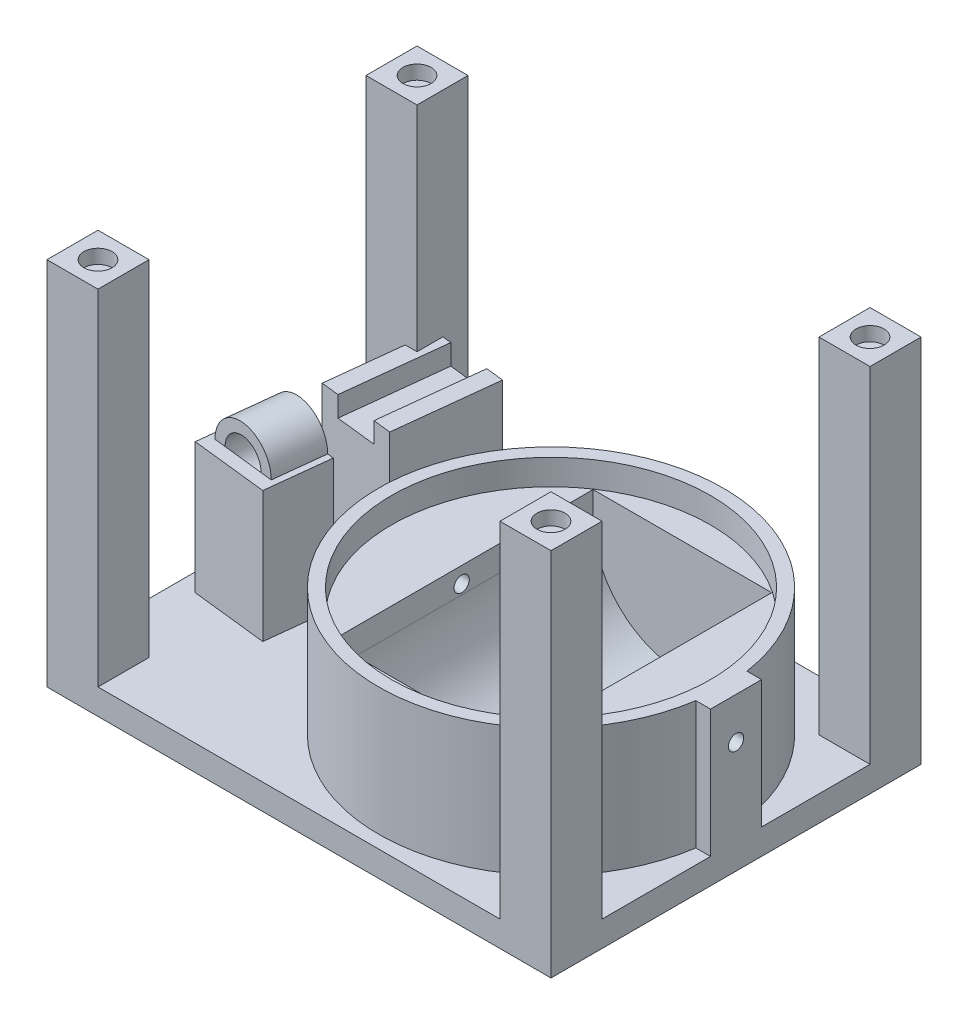
from build123d import *
from build123d.topology import SkipClean

# Parameters (mm, degrees)
SKETCH1_W              = 39.5
SKETCH1_H              = 29
BOSS_EXTRUDE1_DEPTH    = 2
SKETCH2_R              = 13.5
SKETCH2_R_2            = 8.5
BOSS_EXTRUDE2_DEPTH    = 10
SKETCH3_R              = 12.5
CUT_EXTRUDE1_DEPTH     = 2
SKETCH4_R              = 7.5
CUT_EXTRUDE2_DEPTH     = 9
CUT_EXTRUDE3_START     = -10.3
CUT_EXTRUDE3_DEPTH     = 20.6
BOSS_EXTRUDE3_DEPTH    = 10
SKETCH10_W             = 39.5
SKETCH10_H             = 29
SKETCH10_R             = 13.5
CUT_EXTRUDE4_DEPTH     = 10
SKETCH11_R             = 13.5
SKETCH11_W             = 14
SKETCH11_H             = 20.6
BOSS_EXTRUDE4_DEPTH    = 8
SKETCH12_R             = 13.5
SKETCH12_R_2           = 12.5
BOSS_EXTRUDE5_DEPTH    = 2
CUT_SWEEP2_START       = -214.83981443
CUT_SWEEP2_OUTLINE_R   = 0.6
CUT_SWEEP2_DEPTH       = 22.83981443
CUT_SWEEP2_2_OUTLINE_R = 0.6
CUT_SWEEP2_2_ANGLE     = 17.195102
CUT_SWEEP2_START_2     = -205
CUT_SWEEP2_3_OUTLINE_R = 0.6
CUT_SWEEP2_3_DEPTH     = 2.526605635
BOSS_EXTRUDE7_DEPTH    = 10.25
CUT_EXTRUDE5_DEPTH     = 8
SKETCH20_R             = 1.6
CUT_EXTRUDE6_DEPTH     = 4
SKETCH21_R             = 2.5
SKETCH21_R_2           = 1.6
BOSS_EXTRUDE8_DEPTH    = 4
SKETCH22_W             = 4
SKETCH22_H             = 4
BOSS_EXTRUDE9_DEPTH    = 27
BOSS_EXTRUDE11_DEPTH   = 10
SKETCH8_2_R            = 0.6
SKETCH24_R             = 1.1
CUT_EXTRUDE7_DEPTH     = 1.1


with BuildPart() as part:
    # Sketch1 → Boss-Extrude1 (new body)
    with BuildSketch(Plane(origin=(0, 0, 0), x_dir=(1, 0, 0), z_dir=(0, 1, 0))):
        with Locations((-212.126239175, -24.349172792)):
            Rectangle(SKETCH1_W, SKETCH1_H)
    extrude(amount=BOSS_EXTRUDE1_DEPTH)

    # Sketch2 → Boss-Extrude2 (add)
    with BuildSketch(Plane(origin=(0, 2, 0), x_dir=(1, 0, 0), z_dir=(0, 1, 0))):
        with Locations((-206.876239175, -24.349172792)):
            Circle(SKETCH2_R)
        with Locations((-222.376239175, -24.349172792)):
            Circle(SKETCH2_R_2)
    extrude(amount=BOSS_EXTRUDE2_DEPTH)

    # Sketch3 → Cut-Extrude1 (cut)
    with BuildSketch(Plane(origin=(0, 12, 0), x_dir=(1, 0, 0), z_dir=(0, 1, 0))):
        with Locations(Location((-206.876239175, -24.349172792, 0), (0, 0, 270))):
            Circle(SKETCH3_R)
    extrude(amount=-CUT_EXTRUDE1_DEPTH, mode=Mode.SUBTRACT)

    # Sketch4 → Cut-Extrude2 (cut)
    with BuildSketch(Plane(origin=(0, 12, 0), x_dir=(1, 0, 0), z_dir=(0, 1, 0))):
        with Locations(Location((-222.376239175, -24.349172792, 0), (0, 0, 270))):
            Circle(SKETCH4_R)
    extrude(amount=-CUT_EXTRUDE2_DEPTH, mode=Mode.SUBTRACT)

    # Cut-Extrude3: read off the stored shape, not the designer's step
    # Cut-Extrude3 outline → Cut-Extrude3 (cut)
    with BuildSketch(Plane.XY.offset(24.349172792).offset(CUT_EXTRUDE3_START)):
        with BuildLine():
            ThreePointArc((-213.876239175, 8), (-206.876239175, 1), (-199.876239175, 8))
            Line((-199.876239175, 8), (-199.876239175, 10))
            Line((-199.876239175, 10), (-213.876239175, 10))
            Line((-213.876239175, 10), (-213.876239175, 8))
        make_face()
    extrude(amount=CUT_EXTRUDE3_DEPTH, mode=Mode.SUBTRACT)

    # Sketch7 → Boss-Extrude3 (add)
    with BuildSketch(Plane(origin=(0, 2, 0), x_dir=(1, 0, 0), z_dir=(0, 1, 0))):
        with BuildLine():
            Line((-192.376239175, -26.349172792), (-192.376239175, -24.349172792))
            Line((-192.376239175, -24.349172792), (-192.376239175, -22.349172792))
            Line((-192.376239175, -22.349172792), (-193.525209252, -22.349172792))
            ThreePointArc((-193.525209252, -22.349172792), (-193.413533207, -23.346402619), (-193.376239175, -24.349172792))
            ThreePointArc((-193.376239175, -24.349172792), (-193.413533207, -25.351942966), (-193.525209252, -26.349172792))
            Line((-193.525209252, -26.349172792), (-192.376239175, -26.349172792))
        make_face()
    extrude(amount=BOSS_EXTRUDE3_DEPTH)

    # Sketch10 → Cut-Extrude4 (cut)
    with BuildSketch(Plane(origin=(0, 2, 0), x_dir=(1, 0, 0), z_dir=(0, 1, 0))):
        with Locations((-212.126239175, -24.349172792)):
            Rectangle(SKETCH10_W, SKETCH10_H)
        with Locations(Location((-206.876239175, -24.349172792, 0), (0, 0, 151.062655238))):
            Circle(SKETCH10_R, mode=Mode.SUBTRACT)
    extrude(amount=CUT_EXTRUDE4_DEPTH, mode=Mode.SUBTRACT)

    # Sketch11 → Boss-Extrude4 (add)
    with BuildSketch(Plane(origin=(0, 2, 0), x_dir=(1, 0, 0), z_dir=(0, 1, 0))):
        with Locations(Location((-206.876239175, -24.349172792, 0), (0, 0, 151.062655238))):
            Circle(SKETCH11_R)
        with Locations((-206.876239175, -24.349172792)):
            Rectangle(SKETCH11_W, SKETCH11_H, mode=Mode.SUBTRACT)
    extrude(amount=BOSS_EXTRUDE4_DEPTH)

    # Sketch12 → Boss-Extrude5 (add)
    with SkipClean():  # the faces are left unmerged after this step: merging them gives an invalid solid
        with BuildSketch(Plane(origin=(0, 10, 0), x_dir=(1, 0, 0), z_dir=(0, 1, 0))):
            with Locations(Location((-206.876239175, -24.349172792, 0), (0, 0, 270))):
                Circle(SKETCH12_R)
            with Locations(Location((-206.876239175, -24.349172792, 0), (0, 0, 270))):
                Circle(SKETCH12_R_2, mode=Mode.SUBTRACT)
        extrude(amount=BOSS_EXTRUDE5_DEPTH)
    add(part.part.scale(1), mode=Mode.REPLACE)  # the faces are merged on a copy

    # Cut-Sweep2: read off the stored shape, not the designer's step
    # Cut-Sweep2 outline → Cut-Sweep2 (cut)
    with SkipClean():  # the faces are left unmerged after this step: merging them gives an invalid solid
        with BuildSketch(Plane.YZ.offset(CUT_SWEEP2_START)):
            with Locations((8.75, 24.349172792)):
                Circle(CUT_SWEEP2_OUTLINE_R)
        extrude(amount=CUT_SWEEP2_DEPTH, mode=Mode.SUBTRACT)

    # Cut-Sweep2 2 outline → Cut-Sweep2 2 (revolve, cut)
    with SkipClean():  # the faces are left unmerged after this step: merging them gives an invalid solid
        with BuildSketch(Plane(origin=(-214.83981433, 0, 9.349172792), x_dir=(-0.2956263792524328, 0, 0.9553036396298806), z_dir=(-0.9553036396298806, 0, -0.2956263792524328))):
            with Locations((15, 8.75)):
                Circle(CUT_SWEEP2_2_OUTLINE_R)
        revolve(axis=Axis((-214.83981433, 0, 9.349172792), (0, 1, 0)), revolution_arc=CUT_SWEEP2_2_ANGLE, mode=Mode.SUBTRACT)

    # Cut-Sweep2 3 outline → Cut-Sweep2 3 (cut)
    with SkipClean():  # the faces are left unmerged after this step: merging them gives an invalid solid
        with BuildSketch(Plane(origin=(0, 0, 0), x_dir=(0, 1, 0), z_dir=(0.9553036396298961, 0, 0.29562637925238305)).offset(CUT_SWEEP2_START_2)):
            with Locations((8.75, 87.443615225)):
                Circle(CUT_SWEEP2_3_OUTLINE_R)
        extrude(amount=CUT_SWEEP2_3_DEPTH, mode=Mode.SUBTRACT)

    # Sketch18 → Boss-Extrude7 (add)
    with SkipClean():  # the faces are left unmerged after this step: merging them gives an invalid solid
        with BuildSketch(Plane(origin=(0, 2, 0), x_dir=(1, 0, 0), z_dir=(0, 1, 0))):
            Polygon((-228.567210955, -11.746276031), (-229.459691419, -19.696337579), (-226.478418338, -20.031017753), (-225.585937874, -12.080956204), align=None)
            Polygon((-225.585937874, -12.080956204), (-226.478418338, -20.031017753), (-223.497145257, -20.365697927), (-222.604664794, -12.415636378), align=None)
            Polygon((-227.482458859, -28.974836995), (-226.92465857, -24.006048527), (-229.90593165, -23.671368353), (-230.46373194, -28.640156821), align=None)
            Polygon((-223.943385489, -24.340728701), (-226.92465857, -24.006048527), (-227.482458859, -28.974836995), (-224.501185779, -29.309517169), align=None)
        extrude(amount=BOSS_EXTRUDE7_DEPTH)

    # Sketch19 → Cut-Extrude5 (cut)
    with SkipClean():  # the faces are left unmerged after this step: merging them gives an invalid solid
        with BuildSketch(Plane(origin=(-5.039382401, 0, 44.889946486), x_dir=(0.9937576935397466, 0, 0.11156005795338761), z_dir=(-0.11156005795338761, 0, 0.9937576935397466))):
            Polygon((-222.830009143, 12.25), (-224.430009143, 12.25), (-224.430009143, 10.65), (-221.230009143, 10.65), (-221.230009143, 12.25), align=None)
        extrude(amount=-CUT_EXTRUDE5_DEPTH, mode=Mode.SUBTRACT)

    # Sketch20 → Cut-Extrude6 (cut)
    with SkipClean():  # the faces are left unmerged after this step: merging them gives an invalid solid
        with BuildSketch(Plane(origin=(-5.485622633, 0, 48.864977261), x_dir=(-0.9937576935397466, 0, -0.11156005795338761), z_dir=(0.11156005795338761, 0, -0.9937576935397466))):
            with Locations((222.830009143, 12.25)):
                Circle(SKETCH20_R)
        extrude(amount=-CUT_EXTRUDE6_DEPTH, mode=Mode.SUBTRACT)

    # Sketch21 → Boss-Extrude8 (add)
    with SkipClean():  # the faces are left unmerged after this step: merging them gives an invalid solid
        with BuildSketch(Plane(origin=(-5.485622633, 0, 48.864977261), x_dir=(-0.9937576935397466, 0, -0.11156005795338761), z_dir=(0.11156005795338761, 0, -0.9937576935397466))):
            with Locations((222.830009143, 12.25)):
                Circle(SKETCH21_R)
            with Locations((222.830009143, 12.25)):
                Circle(SKETCH21_R_2, mode=Mode.SUBTRACT)
        extrude(amount=-BOSS_EXTRUDE8_DEPTH)

    # Sketch22 → Boss-Extrude9 (add)
    with SkipClean():  # the faces are left unmerged after this step: merging them gives an invalid solid
        with BuildSketch(Plane(origin=(0, 2, 0), x_dir=(1, 0, 0), z_dir=(0, 1, 0))):
            with Locations((-229.876239175, -11.849172792)):
                Rectangle(SKETCH22_W, SKETCH22_H)
            with Locations((-229.876239175, -36.849172792)):
                Rectangle(SKETCH22_W, SKETCH22_H)
            with Locations((-194.376239175, -36.849172792)):
                Rectangle(SKETCH22_W, SKETCH22_H)
            with Locations((-194.376239175, -11.849172792)):
                Rectangle(SKETCH22_W, SKETCH22_H)
        extrude(amount=BOSS_EXTRUDE9_DEPTH)

    # Sketch23 → Boss-Extrude11 (add)
    with BuildSketch(Plane(origin=(0, 2, 0), x_dir=(1, 0, 0), z_dir=(0, 1, 0))):
        with BuildLine():
            Line((-193.376239175, -24.349172792), (-192.376239175, -24.349172792))
            Line((-192.376239175, -24.349172792), (-192.376239175, -22.349172792))
            Line((-192.376239175, -22.349172792), (-193.525209252, -22.349172792))
            ThreePointArc((-193.525209252, -22.349172792), (-193.413533207, -23.346402619), (-193.376239175, -24.349172792))
        make_face()
        with BuildLine():
            Line((-192.376239175, -26.349172792), (-192.376239175, -24.349172792))
            Line((-192.376239175, -24.349172792), (-193.376239175, -24.349172792))
            ThreePointArc((-193.376239175, -24.349172792), (-193.413533207, -25.351942966), (-193.525209252, -26.349172792))
            Line((-193.525209252, -26.349172792), (-192.376239175, -26.349172792))
        make_face()
    extrude(amount=BOSS_EXTRUDE11_DEPTH)

    # Cut-Sweep3: sweep along a path in Sketch17<2>
    with SkipClean():  # the faces are left unmerged after this step: merging them gives an invalid solid
        with BuildLine(Plane(origin=(0, 8.75, 0), x_dir=(1, 0, 0), z_dir=(0, 1, 0))) as cut_sweep3_path:
            Line((-192.376239175, -24.349172792), (-213.876239175, -24.349172792))
            Line((-213.876239175, -24.349172792), (-214.83981433, -24.349172792))
            ThreePointArc((-214.83981433, -24.349172792), (-217.08221049, -24.180614376), (-219.274210018, -23.678727387))
            Line((-219.274210018, -23.678727387), (-220.339151193, -23.349172792))
        # Sketch8<2> → Cut-Sweep3 (sweep, cut)
        with BuildSketch(Plane(origin=(-192.376239175, 0, 0), x_dir=(0, 0, -1), z_dir=(1, 0, 0))):
            with Locations((-24.349172792, 8.75)):
                Circle(SKETCH8_2_R)
        sweep(path=cut_sweep3_path.line, mode=Mode.SUBTRACT)
    add(part.part.scale(1), mode=Mode.REPLACE)  # the faces are merged on a copy

    # Sketch24 → Cut-Extrude7 (cut)
    with BuildSketch(Plane(origin=(0, 29, 0), x_dir=(1, 0, 0), z_dir=(0, 1, 0))):
        with Locations(Location((-229.876239175, -11.849172792, 0), (0, 0, 270))):
            Circle(SKETCH24_R)
        with Locations(Location((-229.876239175, -36.849172792, 0), (0, 0, 270))):
            Circle(SKETCH24_R)
        with Locations(Location((-194.376239175, -36.849172792, 0), (0, 0, 270))):
            Circle(SKETCH24_R)
        with Locations(Location((-194.376239175, -11.849172792, 0), (0, 0, 270))):
            Circle(SKETCH24_R)
    extrude(amount=-CUT_EXTRUDE7_DEPTH, mode=Mode.SUBTRACT)


solid = part.part
